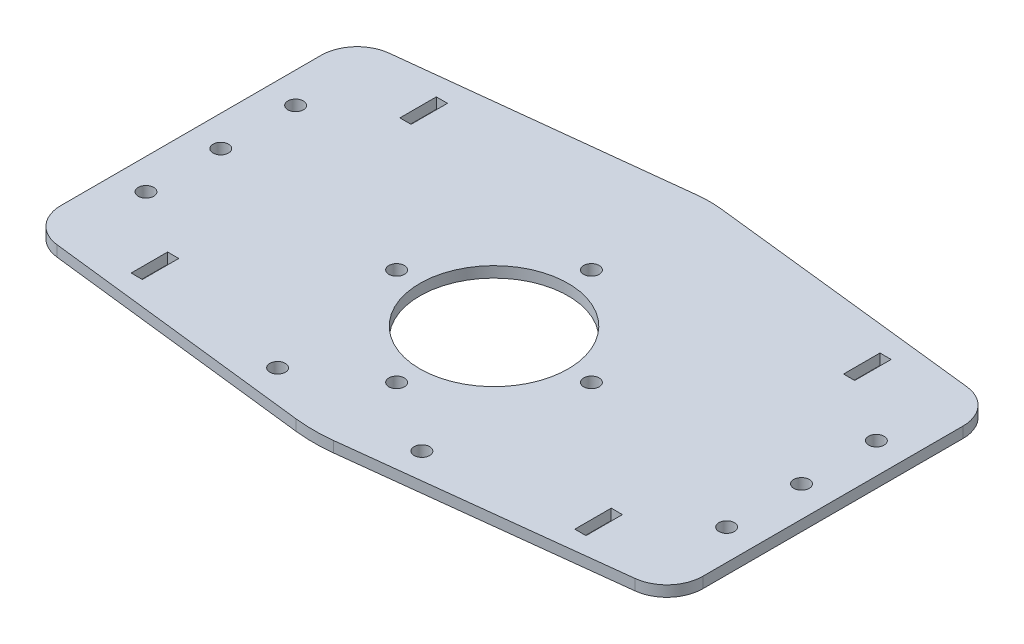
from build123d import *

# Parameters (mm, degrees)
SKETCH1_R                = 20.55
SKETCH1_R_2              = 1
SKETCH1_W                = 3.1
SKETCH1_H                = 10.1
BASE_FLANGE1_DEPTH       = 3
FILLET1_R                = 10
M4_CLEARANCE_HOLE2_D     = 4.3
M4_CLEARANCE_HOLE2_DEPTH = 136
M4_CLEARANCE_HOLE2_TIP   = 1.291850331


# Sheet-metal steps are written as plain solids
with BuildPart() as part:
    # Sketch1 → Base-Flange1 (new body)
    with BuildSketch(Plane(origin=(0, 0, 0), x_dir=(1, 0, 0), z_dir=(0, 1, 0))):
        with BuildLine():
            Line((-89, -40), (-89, 50))
            Line((-89, 50), (-3.349708355, 59.623628275))
            ThreePointArc((-3.349708355, 59.623628275), (0, 59.811223911), (3.349708355, 59.623628275))
            Line((3.349708355, 59.623628275), (89, 50))
            Line((89, 50), (89, -40))
            Line((89, -40), (5.17352088, -49.701618334))
            ThreePointArc((5.17352088, -49.701618334), (0, -50), (-5.17352088, -49.701618334))
            Line((-5.17352088, -49.701618334), (-89, -40))
        make_face()
        with Locations(Location((0, 0, 0), (0, 0, 270))):
            Circle(SKETCH1_R, mode=Mode.SUBTRACT)
        with Locations(Location((0, 27, 0), (0, 0, 270))):
            Circle(SKETCH1_R_2, mode=Mode.SUBTRACT)
        with Locations(Location((-80.5, 25.5, 0), (0, 0, 270))):
            Circle(SKETCH1_R_2, mode=Mode.SUBTRACT)
        with Locations(Location((-80.5, 4.75, 0), (0, 0, 270))):
            Circle(SKETCH1_R_2, mode=Mode.SUBTRACT)
        with Locations(Location((-80.5, -16, 0), (0, 0, 270))):
            Circle(SKETCH1_R_2, mode=Mode.SUBTRACT)
        with Locations(Location((80.5, -16, 0), (0, 0, 90))):
            Circle(SKETCH1_R_2, mode=Mode.SUBTRACT)
        with Locations(Location((80.5, 4.75, 0), (0, 0, 90))):
            Circle(SKETCH1_R_2, mode=Mode.SUBTRACT)
        with Locations(Location((80.5, 25.5, 0), (0, 0, 90))):
            Circle(SKETCH1_R_2, mode=Mode.SUBTRACT)
        with Locations(Location((27, 0, 0), (0, 0, 270))):
            Circle(SKETCH1_R_2, mode=Mode.SUBTRACT)
        with Locations(Location((0, -27, 0), (0, 0, 270))):
            Circle(SKETCH1_R_2, mode=Mode.SUBTRACT)
        with Locations(Location((-27, 0, 0), (0, 0, 270))):
            Circle(SKETCH1_R_2, mode=Mode.SUBTRACT)
        with Locations(Location((20, -40, 0), (0, 0, 270))):
            Circle(SKETCH1_R_2, mode=Mode.SUBTRACT)
        with Locations(Location((-20, -40, 0), (0, 0, 270))):
            Circle(SKETCH1_R_2, mode=Mode.SUBTRACT)
        with Locations((-61.5, 42)):
            Rectangle(SKETCH1_W, SKETCH1_H, mode=Mode.SUBTRACT)
        with Locations((-61.5, -32.5)):
            Rectangle(SKETCH1_W, SKETCH1_H, mode=Mode.SUBTRACT)
        with Locations((61.5, -32.5)):
            Rectangle(SKETCH1_W, SKETCH1_H, mode=Mode.SUBTRACT)
        with Locations((61.5, 42)):
            Rectangle(SKETCH1_W, SKETCH1_H, mode=Mode.SUBTRACT)
    extrude(amount=-BASE_FLANGE1_DEPTH)

    # Fillet1
    fillet1_edges = [part.edges().sort_by_distance(p)[0] for p in [
        (89, -1.5, -50),
        (89, -1.5, 40),
        (-89, -1.5, 40),
        (-89, -1.5, -50),
    ]]
    fillet(fillet1_edges, radius=FILLET1_R)

    # M4 Clearance Hole2
    with Locations(Plane(origin=(0, 0, 0), x_dir=(1, 0, 0), z_dir=(0, 1, 0))):
        with Locations((-27, 0), (0, 27), (27, 0), (0, -27), (20, -40), (-20, -40), (80.5, -16), (80.5, 25.5), (80.5, 4.75), (-80.5, 25.5), (-80.5, 4.75), (-80.5, -16)):
            Hole(M4_CLEARANCE_HOLE2_D / 2, depth=M4_CLEARANCE_HOLE2_DEPTH)
            with Locations((0, 0, -(M4_CLEARANCE_HOLE2_DEPTH + M4_CLEARANCE_HOLE2_TIP / 2))):  # 118° drill point
                Cone(0, M4_CLEARANCE_HOLE2_D / 2, M4_CLEARANCE_HOLE2_TIP, mode=Mode.SUBTRACT)


solid = part.part
